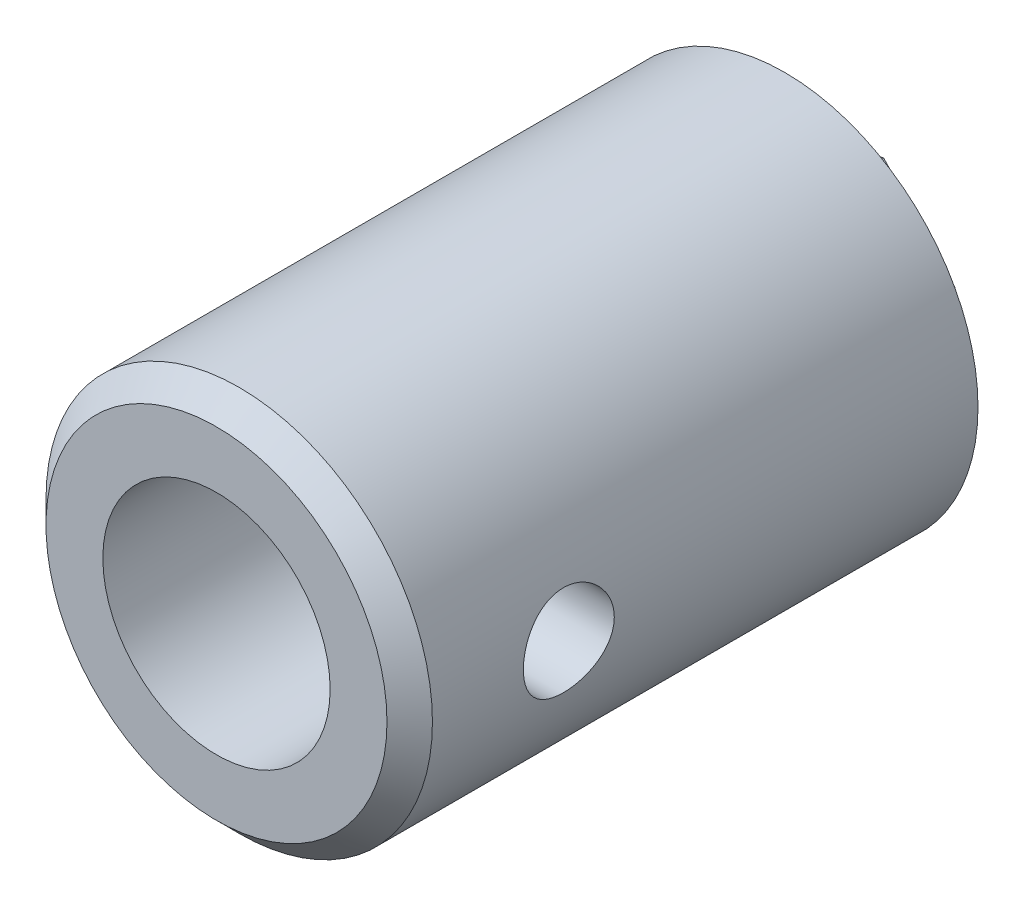
from build123d import *

# Parameters (mm, degrees)
SKETCH1_R           = 8.5
SKETCH1_R_2         = 2
BOSS_EXTRUDE1_DEPTH = 5
SKETCH2_R           = 8.5
SKETCH2_R_2         = 5
BOSS_EXTRUDE2_DEPTH = 20
BOSS_EXTRUDE3_START = 3
SKETCH3_R           = 2
BOSS_EXTRUDE3_DEPTH = 3
CHAMFER1_SIZE       = 1
CUT_EXTRUDE1_REACH  = 33.405
SKETCH4_R           = 2


with BuildPart() as part:
    # Sketch1 → Boss-Extrude1 (new body)
    with BuildSketch(Plane.XY):
        Circle(SKETCH1_R)
        Circle(SKETCH1_R_2, mode=Mode.SUBTRACT)
    extrude(amount=BOSS_EXTRUDE1_DEPTH)

    # Sketch2 → Boss-Extrude2 (add)
    with BuildSketch(Plane.XY.offset(5)):
        Circle(SKETCH2_R)
        Circle(SKETCH2_R_2, mode=Mode.SUBTRACT)
    extrude(amount=BOSS_EXTRUDE2_DEPTH)

    # Sketch3 → Boss-Extrude3 (add)
    with BuildSketch(Plane(origin=(0, 0, 0), x_dir=(-1, 0, 0), z_dir=(0, 0, -1)).offset(BOSS_EXTRUDE3_START)):
        Polygon((-4.500595024, 1.03825708), (-3.149454519, -3.378501083), (1.351140505, -4.416758163), (4.500595024, -1.03825708), (3.149454519, 3.378501083), (-1.351140505, 4.416758163), align=None)
        Circle(SKETCH3_R, mode=Mode.SUBTRACT)
    extrude(amount=-BOSS_EXTRUDE3_DEPTH)

    # Chamfer1
    chamfer1_edges = [part.edges().sort_by_distance(p)[0] for p in [
        (-8.5, 0, 25),
    ]]
    chamfer(chamfer1_edges, length=CHAMFER1_SIZE)

    # Sketch4 → Cut-Extrude1 (cut, up to next)
    with BuildSketch(Plane(origin=(8.5, 0, 0), x_dir=(0, 0, -1), z_dir=(1, 0, 0)), mode=Mode.PRIVATE) as cut_extrude1_sk1:
        with Locations((-18, 0)):
            Circle(SKETCH4_R)
    cut_extrude1_tool1 = extrude(cut_extrude1_sk1.sketch, amount=-CUT_EXTRUDE1_REACH, mode=Mode.PRIVATE) & part.part
    add(cut_extrude1_tool1.solids().sort_by_distance((8.5, 0, 18))[0], mode=Mode.SUBTRACT)


solid = part.part
